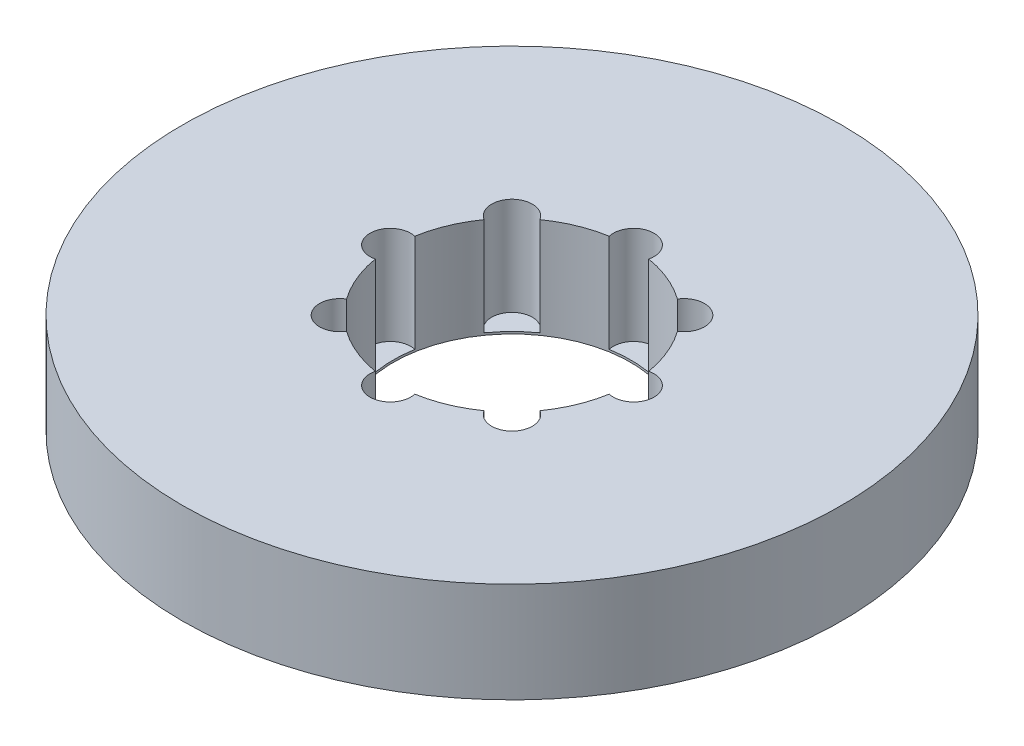
from build123d import *

# Parameters (mm, degrees)
SKETCH1_R           = 62.5
BOSS_EXTRUDE1_DEPTH = 19
SKETCH2_R           = 22.5
CUT_EXTRUDE1_DEPTH  = 91.407411201
SKETCH3_R           = 3.851550946
CUT_EXTRUDE2_DEPTH  = 18.584193111
CIRPATTERN1_COUNT   = 8


with BuildPart() as part:
    # Sketch1 → Boss-Extrude1 (new body)
    with BuildSketch(Plane(origin=(0, 0, 0), x_dir=(1, 0, 0), z_dir=(0, 1, 0))):
        Circle(SKETCH1_R)
    extrude(amount=BOSS_EXTRUDE1_DEPTH)

    # Sketch2 → Cut-Extrude1 (cut, through all)
    with BuildSketch(Plane(origin=(0, 0, 0), x_dir=(1, 0, 0), z_dir=(0, 1, 0))):
        Circle(SKETCH2_R)
    extrude(amount=CUT_EXTRUDE1_DEPTH, mode=Mode.SUBTRACT)

    # Sketch3 → Cut-Extrude2 (cut)
    with BuildSketch(Plane(origin=(0, 19, 0), x_dir=(1, 0, 0), z_dir=(0, 1, 0))):
        with Locations((-23.081275633, 0)):
            Circle(SKETCH3_R)
    cut_extrude2 = extrude(amount=-CUT_EXTRUDE2_DEPTH, mode=Mode.SUBTRACT)

    # CirPattern1: Cut-Extrude2 ×8 about axis
    cirpattern1_axis = Axis((0, 0, 0), (0, 1, 0))
    for i in range(1, CIRPATTERN1_COUNT):
        add(cut_extrude2.rotate(cirpattern1_axis, i * 360 / CIRPATTERN1_COUNT), mode=Mode.SUBTRACT)


solid = part.part
